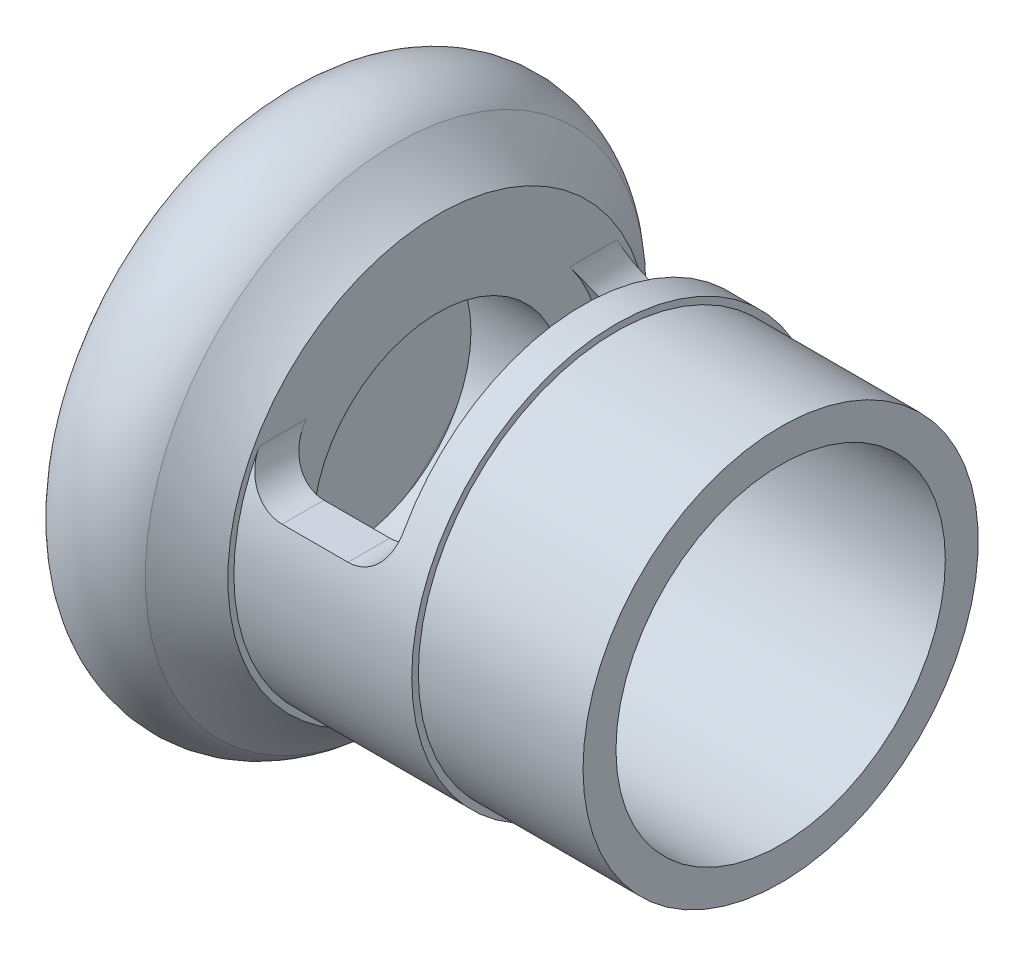
from build123d import *

# Parameters (mm, degrees)
SKETCH3_R               = 31
SKETCH3_R_2             = 25
BOSS_EXTRUDE1_DEPTH     = 22
CUT_EXTRUDE1_DEPTH      = 66.749524713
CUT_EXTRUDE1_DEPTH_BACK = 66.749524713


with BuildPart() as part:
    # Sketch1 → Revolve1 (revolve)
    with BuildSketch(Plane.XY):
        Polygon((49, 25), (19, 25), (19, 31), (24, 31), (24, 30), (49, 30), align=None)
    revolve(axis=Axis((-49, 0, 0), (1, 0, 0)))

    # Sketch3 → Boss-Extrude1 (add)
    with BuildSketch(Plane.ZY.offset(-19)):
        Circle(SKETCH3_R)
        Circle(SKETCH3_R_2, mode=Mode.SUBTRACT)
    extrude(amount=BOSS_EXTRUDE1_DEPTH)

    # Sketch4 → Cut-Extrude1 (cut, two sides: drawn at the far end of the back side and taken through both)
    with BuildSketch(Plane.XY.offset(-CUT_EXTRUDE1_DEPTH_BACK)):
        with BuildLine():
            Line((-3, 31), (19, 31))
            Line((19, 31), (19, 15))
            ThreePointArc((19, 15), (17.242640687, 10.757359313), (13, 9))
            Line((13, 9), (3, 9))
            ThreePointArc((3, 9), (-1.242640687, 10.757359313), (-3, 15))
            Line((-3, 15), (-3, 31))
        make_face()
    extrude(amount=CUT_EXTRUDE1_DEPTH + CUT_EXTRUDE1_DEPTH_BACK, mode=Mode.SUBTRACT)

    # Sketch10 → Revolve2 (revolve)
    with BuildSketch(Plane.XY):
        with BuildLine():
            Line((-3, 19), (-3, 31.912789738))
            ThreePointArc((-3, 31.912789738), (-6.386863103, 34.784968254), (-9.450165565, 38))
            ThreePointArc((-9.450165565, 38), (-21.356134824, 40.100697471), (-28, 30))
            Line((-28, 30), (-28, 0))
            Line((-28, 0), (-25, 0))
            Line((-25, 0), (-25, 30))
            ThreePointArc((-25, 30), (-11.343145751, 35.656854249), (-17, 22))
            Line((-17, 22), (-17, 19))
            Line((-17, 19), (-3, 19))
        make_face()
    revolve(axis=Axis((49, 0, 0), (-1, 0, 0)))


solid = part.part
